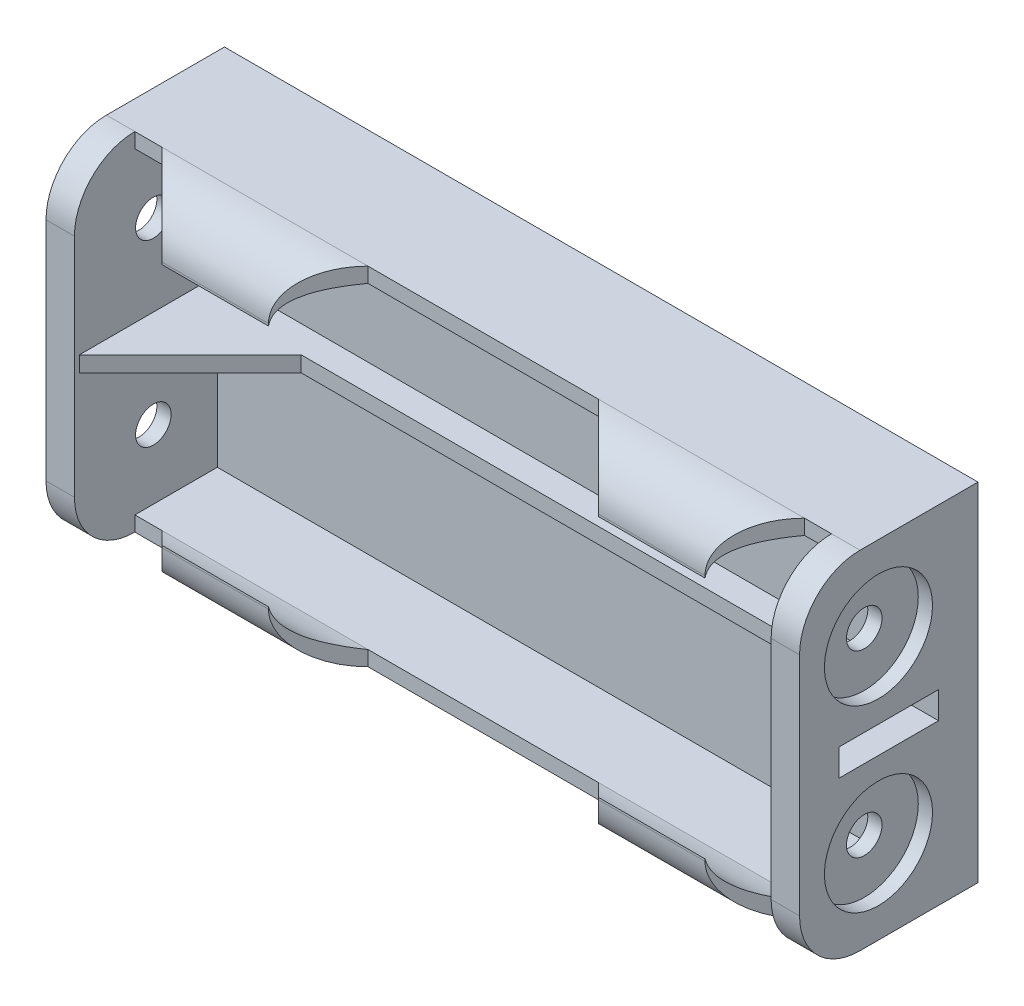
from build123d import *

# Parameters (mm, degrees)
SKICA1_W                 = 53
SKICA1_H                 = 24.4
P_IDAT_VYSUNUT_M1_DEPTH  = 2.5
SKICA2_W                 = 49
SKICA2_H                 = 1.05
P_IDAT_VYSUNUT_M2_DEPTH  = 9.3
SKICA3_W                 = 16.2
SKICA3_H                 = 1.05
SKICA3_W_2               = 1.9
ODEBRAT_VYSUNUT_M1_DEPTH = 3.5
SKICA7_W                 = 14.5
SKICA7_H                 = 3.5
P_IDAT_VYSUNUT_M3_DEPTH  = 2.6
SKICA6_W                 = 14.5
SKICA6_H                 = 3.5
P_IDAT_VYSUNUT_M4_DEPTH  = 2.6
SKICA8_W                 = 14.5
SKICA8_H                 = 3.5
P_IDAT_VYSUNUT_M5_DEPTH  = 2.6
ZAOBLIT3_R               = 3.5
ODEBRAT_START            = -45.2
ODEBRAT_VYSUNUT_M2_DEPTH = 45.2
ODEBRAT_VYSUNUT_M3_DEPTH = 45.2
ZKOSEN_3_SIZE            = 3.5
SKICA14_W                = 2
SKICA14_H                = 24.4
P_IDAT_VYSUNUT_M6_DEPTH  = 10.05
ZAOBLIT4_R               = 4.25
SKICA17_W                = 7
SKICA17_H                = 1.9
ODEBRAT_VYSUNUT_M4_DEPTH = 2.05
SKICA18_R                = 3.8
ODEBRAT_VYSUNUT_M5_DEPTH = 1
SKICA20_R                = 1.25
ODEBRAT_VYSUNUT_M6_DEPTH = 1
ODEBRAT_START_2          = -1
SKICA21_R                = 3.8
ODEBRAT_VYSUNUT_M7_DEPTH = 1
SKICA22_R                = 1.25
ODEBRAT_VYSUNUT_M8_DEPTH = 1
SKICA23_W                = 49
SKICA23_H                = 1.1
P_IDAT_VYSUNUT_M7_DEPTH  = 9.7
SKICA24_W                = 26
SKICA24_H                = 1.1
ODEBRAT_VYSUNUT_M9_DEPTH = 7.8


with BuildPart() as part:
    # Skica1 → Přidat vysunutím1 (new body)
    with BuildSketch(Plane.XY):
        Rectangle(SKICA1_W, SKICA1_H)
    extrude(amount=P_IDAT_VYSUNUT_M1_DEPTH)

    # Skica2 → Přidat vysunutím2 (add)
    with BuildSketch(Plane.XY.offset(2.5)):
        with Locations((0, 11.675)):
            Rectangle(SKICA2_W, SKICA2_H)
        with Locations((0, -11.675)):
            Rectangle(SKICA2_W, SKICA2_H)
    extrude(amount=P_IDAT_VYSUNUT_M2_DEPTH)

    # Skica3 → Odebrat vysunutím1 (cut)
    with BuildSketch(Plane.XY.offset(11.8)):
        with Locations((0, -11.675)):
            Rectangle(SKICA3_W, SKICA3_H)
        with Locations((0, 11.675)):
            Rectangle(SKICA3_W, SKICA3_H)
        with Locations((-23.55, 11.675)):
            Rectangle(SKICA3_W_2, SKICA3_H)
        with Locations((-23.55, -11.675)):
            Rectangle(SKICA3_W_2, SKICA3_H)
        with Locations((23.55, 11.675)):
            Rectangle(SKICA3_W_2, SKICA3_H)
        with Locations((23.55, -11.675)):
            Rectangle(SKICA3_W_2, SKICA3_H)
    extrude(amount=-ODEBRAT_VYSUNUT_M1_DEPTH, mode=Mode.SUBTRACT)

    # Skica7 → Přidat vysunutím3 (add)
    with BuildSketch(Plane(origin=(0, 11.15, 0), x_dir=(-1, 0, 0), z_dir=(0, -1, 0))):
        with Locations((15.35, -10.05)):
            Rectangle(SKICA7_W, SKICA7_H)
        with Locations((-15.35, -10.05)):
            Rectangle(SKICA7_W, SKICA7_H)
    extrude(amount=P_IDAT_VYSUNUT_M3_DEPTH)

    # Skica6 → Přidat vysunutím4 (add)
    with BuildSketch(Plane(origin=(0, -11.15, 0), x_dir=(1, 0, 0), z_dir=(0, 1, 0))):
        with Locations((-15.35, -10.05)):
            Rectangle(SKICA6_W, SKICA6_H)
    extrude(amount=P_IDAT_VYSUNUT_M4_DEPTH)

    # Skica8 → Přidat vysunutím5 (add)
    with BuildSketch(Plane(origin=(0, -11.15, 0), x_dir=(1, 0, 0), z_dir=(0, 1, 0))):
        with Locations((15.35, -10.05)):
            Rectangle(SKICA8_W, SKICA8_H)
    extrude(amount=P_IDAT_VYSUNUT_M5_DEPTH)

    # Zaoblit3
    zaoblit3_edges = [part.edges().sort_by_distance(p)[0] for p in [
        (15.35, 12.2, 11.8),
        (-15.35, 12.2, 11.8),
        (-15.35, -12.2, 11.8),
        (15.35, -12.2, 11.8),
    ]]
    fillet(zaoblit3_edges, radius=ZAOBLIT3_R)

    # Skica11 → Odebrat vysunutím2 (cut)
    with BuildSketch(Plane(origin=(22.6, 0, 0), x_dir=(0, 0, -1), z_dir=(1, 0, 0)).offset(ODEBRAT_START)):
        with BuildLine():
            Line((-11.8, -8.55), (-8.3, -8.55))
            Line((-8.3, -8.55), (-8.3, -11.15))
            add(Edge.make_bspline(
                [(-8.3, -11.15), (-11.489612279, -10.573938185), (-11.8, -8.55)],
                knots=[0, 0, 0, 0.822635588, 0.822635588, 0.822635588], degree=2))
        make_face()
    extrude(amount=ODEBRAT_VYSUNUT_M2_DEPTH, mode=Mode.SUBTRACT)

    # Skica13 → Odebrat vysunutím3 (cut)
    with BuildSketch(Plane(origin=(22.6, 0, 0), x_dir=(0, 0, -1), z_dir=(1, 0, 0)).offset(ODEBRAT_START)):
        with BuildLine():
            Line((-11.8, 8.55), (-8.3, 8.55))
            Line((-8.3, 8.55), (-8.3, 11.15))
            add(Edge.make_bspline(
                [(-8.3, 11.15), (-11.594475323, 10.62667069), (-11.8, 8.55)],
                knots=[0, 0, 0, 0.882557327, 0.882557327, 0.882557327], degree=2))
        make_face()
    extrude(amount=ODEBRAT_VYSUNUT_M3_DEPTH, mode=Mode.SUBTRACT)

    # Zkosení3
    # the kernel refuses this chamfer: 3.5 mm, written as the material it takes off along each edge
    with BuildSketch(Plane(origin=(-22.6, 0.450890458, 11.8), x_dir=(-0.027495876610586112, 0, -0.9996219169112968), z_dir=(0, -1, 0)), Plane(origin=(-8.1, 0.450890458, 11.8), x_dir=(-0.9996219169112968, 0, 0.027495876610586605), z_dir=(0, -1, 0)), Plane(origin=(-22.6, -0.450890458, 11.8), x_dir=(0.9996219169112968, 3.891912830509087e-15, 0.02749587661058662), z_dir=(0, 1, 0)), Plane(origin=(-8.1, -0.450890458, 11.8), x_dir=(0.027495876610586605, 0, -0.9996219169112968), z_dir=(0, 1, 0)), Plane(origin=(8.1, -0.450890458, 11.8), x_dir=(0.9996219169112968, 0, 0.027495876610586605), z_dir=(0, 1, 0)), Plane(origin=(22.6, -0.450890458, 11.8), x_dir=(0.027495876610586112, 0, -0.9996219169112968), z_dir=(0, 1, 0)), Plane(origin=(8.1, 0.450890458, 11.8), x_dir=(-0.027495876610586605, 0, -0.9996219169112968), z_dir=(0, -1, 0)), Plane(origin=(22.6, 0.450890458, 11.8), x_dir=(-0.9996219169112968, 3.891912830509087e-15, 0.02749587661058662), z_dir=(0, -1, 0))) as zkosen_3_piece_1:
        Polygon((ZKOSEN_3_SIZE * 0.999621916911, ZKOSEN_3_SIZE * 0.0274958766106), (-ZKOSEN_3_SIZE * 0.0274958766106, ZKOSEN_3_SIZE * 0.999621916911), (0, 0), align=None)
    extrude(amount=18.151780916, mode=Mode.SUBTRACT)

    # Skica14 → Přidat vysunutím6 (add)
    with BuildSketch(Plane.XY.offset(2.5)):
        with Locations((25.5, 0)):
            Rectangle(SKICA14_W, SKICA14_H)
        with Locations((-25.5, 0)):
            Rectangle(SKICA14_W, SKICA14_H)
    extrude(amount=P_IDAT_VYSUNUT_M6_DEPTH)

    # Zaoblit4
    zaoblit4_edges = [part.edges().sort_by_distance(p)[0] for p in [
        (-25.5, 12.2, 12.55),
        (-25.5, -12.2, 12.55),
        (25.5, -12.2, 12.55),
        (25.5, 12.2, 12.55),
    ]]
    fillet(zaoblit4_edges, radius=ZAOBLIT4_R)

    # Skica17 → Odebrat vysunutím4 (cut)
    with BuildSketch(Plane(origin=(26.5, 0, 0), x_dir=(0, 0, -1), z_dir=(1, 0, 0))):
        with Locations((-6.275, 0)):
            Rectangle(SKICA17_W, SKICA17_H)
    extrude(amount=-ODEBRAT_VYSUNUT_M4_DEPTH, mode=Mode.SUBTRACT)

    # Skica18 → Odebrat vysunutím5 (cut)
    with BuildSketch(Plane(origin=(26.5, 0, 0), x_dir=(0, 0, -1), z_dir=(1, 0, 0))):
        with Locations((-7, 6.3)):
            Circle(SKICA18_R)
        with Locations((-7, -6.3)):
            Circle(SKICA18_R)
    extrude(amount=-ODEBRAT_VYSUNUT_M5_DEPTH, mode=Mode.SUBTRACT)

    # Skica20 → Odebrat vysunutím6 (cut)
    with BuildSketch(Plane(origin=(25.5, 0, 0), x_dir=(0, 0, -1), z_dir=(1, 0, 0))):
        with Locations((-7, -6.3)):
            Circle(SKICA20_R)
        with Locations((-7, 6.3)):
            Circle(SKICA20_R)
    extrude(amount=-ODEBRAT_VYSUNUT_M6_DEPTH, mode=Mode.SUBTRACT)

    # Skica21 → Odebrat vysunutím7 (cut)
    with BuildSketch(Plane.ZY.offset(26.5).offset(ODEBRAT_START_2)):
        with Locations(Location((7, 6.3, 0), (0, 0, 180))):
            Circle(SKICA21_R)
        with Locations(Location((7, -6.3, 0), (0, 0, 180))):
            Circle(SKICA21_R)
    extrude(amount=ODEBRAT_VYSUNUT_M7_DEPTH, mode=Mode.SUBTRACT)

    # Skica22 → Odebrat vysunutím8 (cut)
    with BuildSketch(Plane.ZY.offset(25.5).offset(ODEBRAT_START_2)):
        with Locations(Location((7, -6.3, 0), (0, 0, 180))):
            Circle(SKICA22_R)
        with Locations(Location((7, 6.3, 0), (0, 0, 180))):
            Circle(SKICA22_R)
    extrude(amount=ODEBRAT_VYSUNUT_M8_DEPTH, mode=Mode.SUBTRACT)

    # Skica23 → Přidat vysunutím7 (add)
    with BuildSketch(Plane.XY.offset(2.5)):
        Rectangle(SKICA23_W, SKICA23_H)
    extrude(amount=P_IDAT_VYSUNUT_M7_DEPTH)

    # Skica24 → Odebrat vysunutím9 (cut)
    with BuildSketch(Plane.XY.offset(12.2)):
        Rectangle(SKICA24_W, SKICA24_H)
    extrude(amount=-ODEBRAT_VYSUNUT_M9_DEPTH, mode=Mode.SUBTRACT)

    # Zkosení5
    # the kernel refuses this chamfer: 11.5 mm, written as the material it takes off along each edge
    with BuildSketch(Plane(origin=(-13, -0.55, 12.2), x_dir=(-0.9996219169112968, 0, 0.027495876610586382), z_dir=(0, 1, 0))) as zkosen_5_piece_1_section:
        with BuildLine():
            Line((11.829741745, 0), (-0.650292281, -11.811854626))
            Line((-0.650292281, -11.811854626), (-0.880205322, -11.805530574))
            ThreePointArc((-0.880205322, -11.805530574), (-0.392486111, -5.904075041), (-0.229913041, 0.006324052))
            Line((-0.229913041, 0.006324052), (0.006324052, 0.229913041))
            ThreePointArc((0.006324052, 0.229913041), (5.916723144, 0.067339971), (11.836065796, 0.229913041))
            Line((11.836065796, 0.229913041), (11.829741745, 0))
        make_face()
    zkosen_5_piece_1 = extrude(amount=1.1, mode=Mode.PRIVATE)
    zkosen_5_piece_1 = split(zkosen_5_piece_1, bisect_by=Plane(origin=(-24.5, 0, 9.11358538), z_dir=(1, 0, 0)), keep=Keep.TOP, mode=Mode.PRIVATE)
    zkosen_5_piece_1 = split(zkosen_5_piece_1, bisect_by=Plane(origin=(-17.151338027, 0, 4.4), z_dir=(0, 0, 1)), keep=Keep.TOP, mode=Mode.PRIVATE)
    add(zkosen_5_piece_1, mode=Mode.SUBTRACT)

    # Zkosení6
    # the kernel refuses this chamfer: 11.5 mm, written as the material it takes off along each edge
    with BuildSketch(Plane(origin=(13, 0.55, 12.2), x_dir=(-0.02749587661058638, 0, -0.9996219169112968), z_dir=(0, -1, 0))) as zkosen_6_piece_1_section:
        with BuildLine():
            Line((11.829741745, 0), (-0.650292281, 11.811854626))
            Line((-0.650292281, 11.811854626), (-0.880205322, 11.805530574))
            ThreePointArc((-0.880205322, 11.805530574), (-0.392486111, 5.904075041), (-0.229913041, -0.006324052))
            Line((-0.229913041, -0.006324052), (0.006324052, -0.229913041))
            ThreePointArc((0.006324052, -0.229913041), (5.916723144, -0.067339971), (11.836065796, -0.229913041))
            Line((11.836065796, -0.229913041), (11.829741745, 0))
        make_face()
    zkosen_6_piece_1 = extrude(amount=1.1, mode=Mode.PRIVATE)
    zkosen_6_piece_1 = split(zkosen_6_piece_1, bisect_by=Plane(origin=(24.5, 0, 9.11358538), z_dir=(-1, 0, 0)), keep=Keep.TOP, mode=Mode.PRIVATE)
    zkosen_6_piece_1 = split(zkosen_6_piece_1, bisect_by=Plane(origin=(17.151338027, 0, 4.4), z_dir=(0, 0, 1)), keep=Keep.TOP, mode=Mode.PRIVATE)
    add(zkosen_6_piece_1, mode=Mode.SUBTRACT)


solid = part.part
